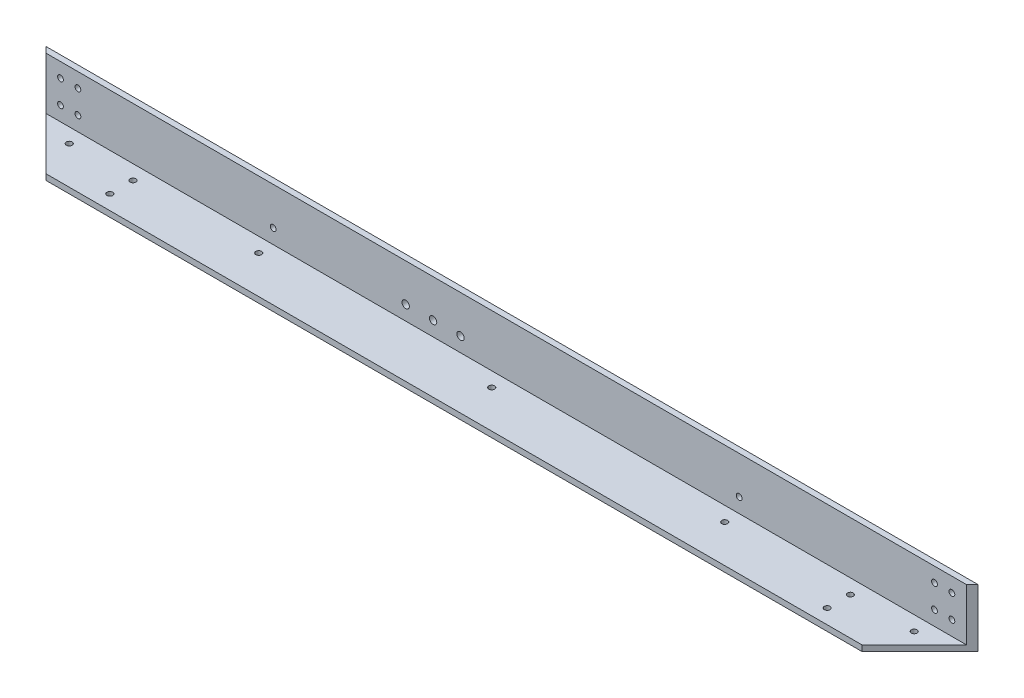
from build123d import *

# Parameters (mm, degrees)
BOSS_EXTRUDE1_DEPTH          = 510
CHAMFER6_SIZE                = 31.75
CHAMFER7_SIZE                = 31.75
TOPHOLES_SKETCH3_R           = 1.5875
TOPHOLES_CUT_EXTRUDE2_DEPTH  = 512.785690622
SIDEHOLES_SKETCH4_R          = 1.5875
SIDEHOLES_SKETCH4_R_2        = 2
SIDEHOLES_CUT_EXTRUDE3_DEPTH = 512.785690622


with BuildPart() as part:
    # Sketch1 → Boss-Extrude1 (new body)
    with BuildSketch(Plane(origin=(0, 0, 0), x_dir=(0, 0, -1), z_dir=(1, 0, 0))):
        Polygon((0, 0), (-31.75, 0), (-31.75, 3.175), (-3.175, 3.175), (-3.175, 31.75), (0, 31.75), align=None)
    extrude(amount=BOSS_EXTRUDE1_DEPTH)

    # Chamfer6
    chamfer6_edges = [part.edges().sort_by_distance(p)[0] for p in [
        (510, 1.5875, 31.75),
    ]]
    chamfer(chamfer6_edges, length=CHAMFER6_SIZE - 0.0001)  # a hair under: the kernel refuses the full size

    # Chamfer7
    chamfer7_edges = [part.edges().sort_by_distance(p)[0] for p in [
        (0, 1.5875, 31.75),
    ]]
    chamfer(chamfer7_edges, length=CHAMFER7_SIZE - 0.0001)  # a hair under: the kernel refuses the full size

    # TopHoles-Sketch3 → TopHoles-Cut-Extrude2 (cut, through all)
    with BuildSketch(Plane(origin=(0, 3.175, 0), x_dir=(1, 0, 0), z_dir=(0, 1, 0))):
        with Locations(Location((58.7375, -23.8125, 0), (0, 0, 270))):
            Circle(TOPHOLES_SKETCH3_R)
        with Locations(Location((451.2625, -23.8125, 0), (0, 0, 270))):
            Circle(TOPHOLES_SKETCH3_R)
        with Locations(Location((451.2625, -11.1125, 0), (0, 0, 270))):
            Circle(TOPHOLES_SKETCH3_R)
        with Locations(Location((58.7375, -11.1125, 0), (0, 0, 270))):
            Circle(TOPHOLES_SKETCH3_R)
        with Locations(Location((486.1875, -11.1125, 0), (0, 0, 270))):
            Circle(TOPHOLES_SKETCH3_R)
        with Locations(Location((23.8125, -11.1125, 0), (0, 0, 270))):
            Circle(TOPHOLES_SKETCH3_R)
        with Locations(Location((127.5, -11.1125, 0), (0, 0, 270))):
            Circle(TOPHOLES_SKETCH3_R)
        with Locations(Location((255, -11.1125, 0), (0, 0, 270))):
            Circle(TOPHOLES_SKETCH3_R)
        with Locations(Location((382.5, -11.1125, 0), (0, 0, 270))):
            Circle(TOPHOLES_SKETCH3_R)
    extrude(amount=-TOPHOLES_CUT_EXTRUDE2_DEPTH, mode=Mode.SUBTRACT)

    # SideHoles-Sketch4 → SideHoles-Cut-Extrude3 (cut, through all)
    with BuildSketch(Plane.XY.offset(3.175)):
        with Locations((11.1125, 23.8125)):
            Circle(SIDEHOLES_SKETCH4_R)
        with Locations((489.3625, 23.8125)):
            Circle(SIDEHOLES_SKETCH4_R)
        with Locations((20.6375, 23.8125)):
            Circle(SIDEHOLES_SKETCH4_R)
        with Locations((498.8875, 23.8125)):
            Circle(SIDEHOLES_SKETCH4_R)
        with Locations((11.1125, 11.1125)):
            Circle(SIDEHOLES_SKETCH4_R)
        with Locations((20.6375, 11.1125)):
            Circle(SIDEHOLES_SKETCH4_R)
        with Locations((489.3625, 11.1125)):
            Circle(SIDEHOLES_SKETCH4_R)
        with Locations((498.8875, 11.1125)):
            Circle(SIDEHOLES_SKETCH4_R)
        with Locations((200, 11.1125)):
            Circle(SIDEHOLES_SKETCH4_R_2)
        with Locations((215, 11.1125)):
            Circle(SIDEHOLES_SKETCH4_R_2)
        with Locations((230, 11.1125)):
            Circle(SIDEHOLES_SKETCH4_R_2)
        with Locations((127.5, 11.1125)):
            Circle(SIDEHOLES_SKETCH4_R)
        with Locations((382.5, 11.1125)):
            Circle(SIDEHOLES_SKETCH4_R)
    extrude(amount=-SIDEHOLES_CUT_EXTRUDE3_DEPTH, mode=Mode.SUBTRACT)


solid = part.part
